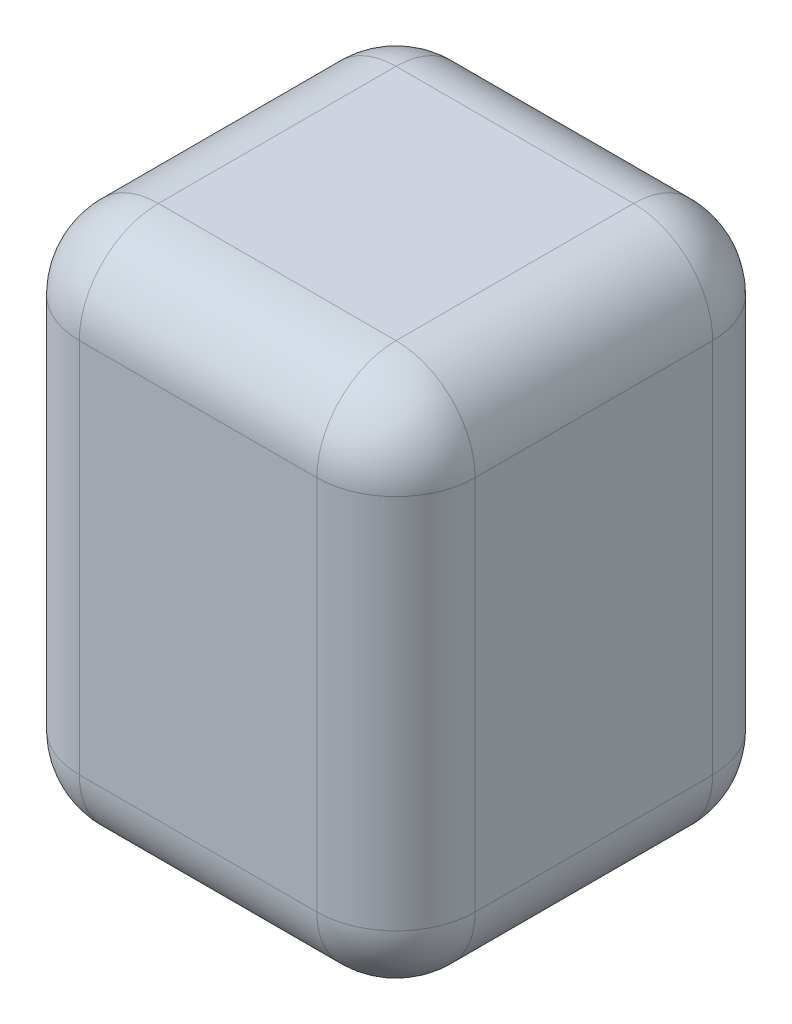
from build123d import *

# Parameters (mm, degrees)
SKETCH1_W           = 100
SKETCH1_H           = 100
BOSS_EXTRUDE1_DEPTH = 135
FILLET1_R           = 20
SHELL1_T            = 1.5


with BuildPart() as part:
    # Sketch1 → Boss-Extrude1 (new body)
    with BuildSketch(Plane(origin=(0, 0, 0), x_dir=(1, 0, 0), z_dir=(0, 1, 0))):
        Rectangle(SKETCH1_W, SKETCH1_H)
    extrude(amount=BOSS_EXTRUDE1_DEPTH)

    # Fillet1
    fillet1_edges = [part.edges().sort_by_distance(p)[0] for p in [
        (0, 0, -50),
        (50, 67.5, -50),
        (50, 0, 0),
        (-50, 67.5, -50),
        (-50, 0, 0),
        (-50, 67.5, 50),
        (50, 67.5, 50),
        (0, 0, 50),
        (0, 135, -50),
        (50, 135, 0),
        (0, 135, 50),
        (-50, 135, 0),
    ]]
    fillet(fillet1_edges, radius=FILLET1_R)

    # Shell1 (no face opened: a closed hollow body)
    add(offset(amount=-SHELL1_T, mode=Mode.PRIVATE), mode=Mode.SUBTRACT)


solid = part.part
